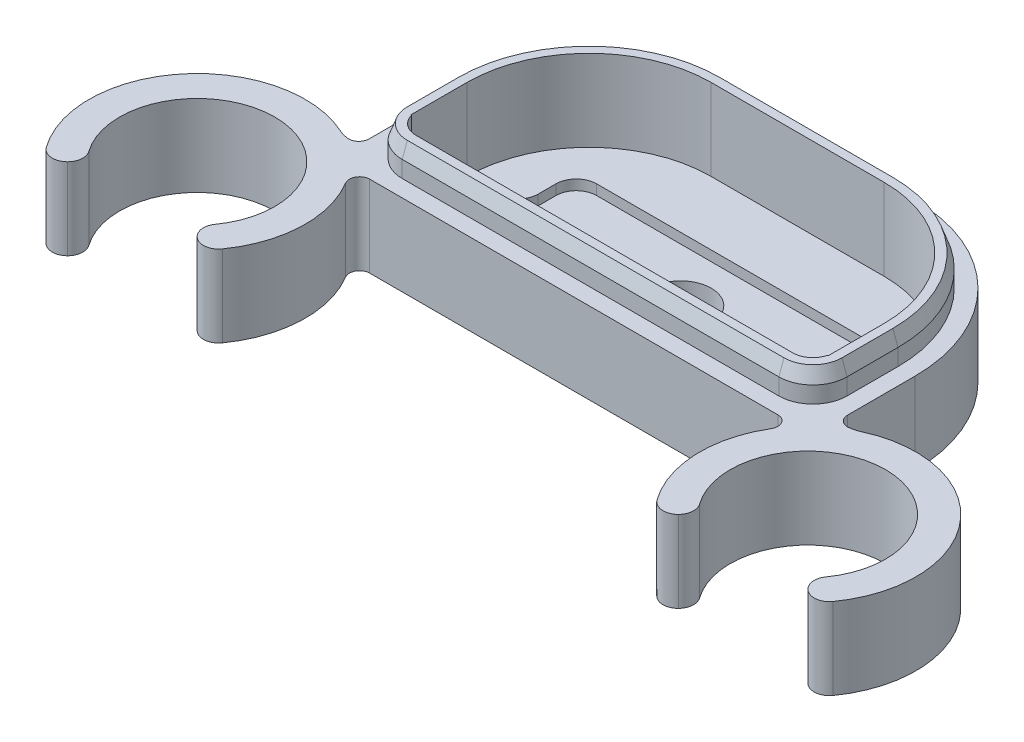
from build123d import *

# Parameters (mm, degrees)
SKETCH1_W               = 47
SKETCH1_H               = 25
BOSS_EXTRUDE1_DEPTH     = 8
SHELL1_T                = -3
SKETCH4_R               = 3
SKETCH4_W               = 9.5
SKETCH4_H               = 4.5
CUT_EXTRUDE4_DEPTH      = 28.793884219
FILLET2_R               = 12
FILLET3_R               = 15
SKETCH5_R               = 7.625
BOSS_EXTRUDE3_DEPTH     = 8
FILLET7_R               = 2
FILLET9_R               = 3
FILLET10_R              = 3
BOSS_EXTRUDE4_DEPTH     = 3
FILLET11_R              = 1
CHAMFER1_SIZE           = 0.5
CHAMFER1_SIZE2          = 1.37373871
CUT_EXTRUDE5_DEPTH      = 10
CUT_EXTRUDE5_DEPTH_BACK = 1
CUT_EXTRUDE6_DEPTH      = 10
FILLET12_R              = 1.5


# Some blends are built 0.0001 mm under size
with BuildPart() as part:
    # Sketch1 → Boss-Extrude1 (new body)
    with BuildSketch(Plane(origin=(0, 0, 0), x_dir=(1, 0, 0), z_dir=(0, 1, 0))):
        Rectangle(SKETCH1_W, SKETCH1_H)
    extrude(amount=BOSS_EXTRUDE1_DEPTH)

    # Shell1
    shell1_openings = [part.faces().sort_by_distance(p)[0] for p in [
        (0, 8, 0),
    ]]
    offset(amount=SHELL1_T, openings=shell1_openings, kind=Kind.INTERSECTION)

    # Sketch4 → Cut-Extrude4 (cut, through all)
    with BuildSketch(Plane.XZ):
        with Locations(Location((0, 2, 0), (0, 0, 270))):
            Circle(SKETCH4_R)
        with Locations((10.75, 4.5)):
            Rectangle(SKETCH4_W, SKETCH4_H)
        with Locations((-10.75, 4.5)):
            Rectangle(SKETCH4_W, SKETCH4_H)
    extrude(amount=-CUT_EXTRUDE4_DEPTH, mode=Mode.SUBTRACT)

    # Fillet2
    fillet2_edges = [part.edges().sort_by_distance(p)[0] for p in [
        (-20.5, 5.5, -9.5),
        (20.5, 5.5, -9.5),
    ]]
    fillet(fillet2_edges, radius=FILLET2_R)

    # Fillet3
    fillet3_edges = [part.edges().sort_by_distance(p)[0] for p in [
        (-23.5, 4, -12.5),
        (23.5, 4, -12.5),
    ]]
    fillet(fillet3_edges, radius=FILLET3_R)

    # Sketch5 → Boss-Extrude3 (add)
    # profile 1 of 2: a face of its own
    with BuildSketch(Plane(origin=(0, 0, 0), x_dir=(1, 0, 0), z_dir=(0, 1, 0))):
        with BuildLine():
            Line((-24.109061312, -10.65763231), (-23.023781022, -9.5))
            Line((-23.023781022, -9.5), (-18.817115042, -9.5))
            Line((-18.817115042, -9.5), (-21.851077989, -12.681958121))
            ThreePointArc((-21.851077989, -12.681958121), (-37.092523941, -27.411177481), (-24.109061312, -10.65763231))
        make_face()
        with Locations(Location((-30, -19.5, 0), (0, 0, 270))):
            Circle(SKETCH5_R, mode=Mode.SUBTRACT)
    # profile 2 of 2: a face of its own
    with BuildSketch(Plane(origin=(0, 0, 0), x_dir=(1, 0, 0), z_dir=(0, 1, 0))):
        with BuildLine():
            Line((21.851077989, -12.681958121), (18.817115042, -9.5))
            Line((18.817115042, -9.5), (23.023781022, -9.5))
            Line((23.023781022, -9.5), (24.109061312, -10.65763231))
            ThreePointArc((24.109061312, -10.65763231), (37.092523941, -27.411177481), (21.851077989, -12.681958121))
        make_face()
        with Locations(Location((30, -19.5, 0), (0, 0, 90))):
            Circle(SKETCH5_R, mode=Mode.SUBTRACT)
    extrude(amount=BOSS_EXTRUDE3_DEPTH)

    # Fillet7
    fillet7_edges = [part.edges().sort_by_distance(p)[0] for p in [
        (-20.5, 5.5, 9.5),
        (20.5, 5.5, 9.5),
    ]]
    fillet(fillet7_edges, radius=FILLET7_R)

    # Fillet9
    # the kernel refuses this fillet: 3 mm, written as the material it adds along each edge
    with BuildSketch(Plane(origin=(-24.109061312, 0, 10.65763231), x_dir=(-0.8731241588548913, 0, -0.48749790073798127), z_dir=(0, 1, 0))) as fillet9_piece_1:
        with BuildLine():
            CenterArc((1.900937986, -2.990768498), FILLET9_R, 94.495982628, 40.36086399)
            Line((-0.215075627, -0.864154666), (-0.2573959, -0.82162239))
            ThreePointArc((-0.2573959, -0.82162239), (-0.165761599, -0.417586273), (-0.058223785, 0.01449106))
            Line((-0.058223785, 0.01449106), (0.004703352, 0.05981537))
            ThreePointArc((0.004703352, 0.05981537), (0.8328852, 0.027305096), (1.661067049, 0.05981537))
            Line((1.661067049, 0.05981537), (1.6657704, 0))
        make_face()
    extrude(amount=8)
    with BuildSketch(Plane(origin=(24.109061312, 0, 10.65763231), x_dir=(-0.6839411288813303, 0, -0.7295372041400846), z_dir=(0, 1, 0))) as fillet9_piece_2:
        with BuildLine():
            CenterArc((2.443120942, -2.566986852), FILLET9_R, 121.167021746, 40.36086399)
            Line((-0.402312981, -1.616457637), (-0.45922166, -1.597447053))
            ThreePointArc((-0.45922166, -1.597447053), (-0.227653258, -0.801634155), (-0.059180564, 0.009882353))
            Line((-0.059180564, 0.009882353), (0, 0.06))
            ThreePointArc((0, 0.06), (0.44525858, 0.06), (0.859465085, 0.051339737))
            Line((0.859465085, 0.051339737), (0.89051716, 0))
        make_face()
    extrude(amount=8)

    # Fillet10
    # the kernel refuses this fillet: 3 mm, written as the material it adds along each edge
    with BuildSketch(Plane(origin=(-21.851077989, 0, 12.681958121), x_dir=(0.6041926909004034, 0, 0.796838247238754), z_dir=(0, 1, 0))) as fillet10_piece_1:
        with BuildLine():
            CenterArc((1.162533412, 2.99655072), FILLET10_R, 246.365543593, 20.886670937)
            Line((-0.040166708, 0.248185312), (-0.064220711, 0.193218004))
            ThreePointArc((-0.064220711, 0.193218004), (-0.07931268, 0.114506887), (-0.059229326, -0.009585769))
            Line((-0.059229326, -0.009585769), (0.002876371, -0.059931014))
            ThreePointArc((0.002876371, -0.059931014), (0.509357423, -0.047783801), (1.015838475, -0.059931014))
            Line((1.015838475, -0.059931014), (1.018714846, 0))
        make_face()
    extrude(amount=8)
    with BuildSketch(Plane(origin=(21.851077989, 0, 12.681958121), x_dir=(-0.6041926909004038, 0, 0.7968382472387535), z_dir=(0, 1, 0))) as fillet10_piece_2:
        with BuildLine():
            CenterArc((1.162533412, -2.99655072), FILLET10_R, 92.74778547, 20.886670937)
            Line((-0.040166708, -0.248185312), (-0.064220711, -0.193218004))
            ThreePointArc((-0.064220711, -0.193218004), (-0.07931268, -0.114506887), (-0.059229326, 0.009585769))
            Line((-0.059229326, 0.009585769), (0.002876371, 0.059931014))
            ThreePointArc((0.002876371, 0.059931014), (0.509357423, 0.047783801), (1.015838475, 0.059931014))
            Line((1.015838475, 0.059931014), (1.018714846, 0))
        make_face()
    extrude(amount=8)

    # Sketch6 → Boss-Extrude4 (add)
    with BuildSketch(Plane(origin=(0, 8, 0), x_dir=(1, 0, 0), z_dir=(0, 1, 0))):
        with BuildLine():
            Line((-21.85, -2.5), (-21.85, -7.5))
            ThreePointArc((-21.85, -7.5), (-20.868807717, -9.868807717), (-18.5, -10.85))
            Line((-18.5, -10.85), (18.5, -10.85))
            ThreePointArc((18.5, -10.85), (20.868807717, -9.868807717), (21.85, -7.5))
            Line((21.85, -7.5), (21.85, -2.5))
            ThreePointArc((21.85, -2.5), (17.939875529, 6.939875529), (8.5, 10.85))
            Line((8.5, 10.85), (-8.5, 10.85))
            ThreePointArc((-8.5, 10.85), (-17.939875529, 6.939875529), (-21.85, -2.5))
        make_face()
        with BuildLine():
            Line((-18.5, -9.5), (18.5, -9.5))
            ThreePointArc((18.5, -9.5), (19.914213562, -8.914213562), (20.5, -7.5))
            Line((20.5, -7.5), (20.5, -2.5))
            ThreePointArc((20.5, -2.5), (16.985281374, 5.985281374), (8.5, 9.5))
            Line((8.5, 9.5), (-8.5, 9.5))
            ThreePointArc((-8.5, 9.5), (-16.985281374, 5.985281374), (-20.5, -2.5))
            Line((-20.5, -2.5), (-20.5, -7.5))
            ThreePointArc((-20.5, -7.5), (-19.914213562, -8.914213562), (-18.5, -9.5))
        make_face(mode=Mode.SUBTRACT)
    extrude(amount=BOSS_EXTRUDE4_DEPTH)

    # Fillet11
    fillet11_edges = [part.edges().sort_by_distance(p)[0] for p in [
        (21.677582872, 4, 12.5),
        (23.5, 4, 10.00796691),
        (-21.677582872, 4, 12.5),
        (-23.5, 4, 10.00796691),
    ]]
    fillet(fillet11_edges, radius=FILLET11_R)

    # Chamfer1
    chamfer1_edges = [part.edges().sort_by_distance(p)[0] for p in [
        (-17.939875529, 11, -6.939875529),
        (-21.85, 11, 5),
        (-20.868807717, 11, 9.868807717),
        (0, 11, 10.85),
        (20.868807717, 11, 9.868807717),
        (21.85, 11, 5),
        (17.939875529, 11, -6.939875529),
        (0, 11, -10.85),
    ]]
    chamfer1_side = [part.faces().sort_by_distance(p)[0] for p in [
        (-21.362088123, 11, 5),
    ]]
    chamfer(chamfer1_edges, length=CHAMFER1_SIZE, length2=CHAMFER1_SIZE2, reference=chamfer1_side[0])

    # Sketch7 → Cut-Extrude5 (cut, two sides: drawn at the far end of the back side and taken through both)
    with BuildSketch(Plane(origin=(0, 3, 0), x_dir=(1, 0, 0), z_dir=(0, 1, 0)).offset(-CUT_EXTRUDE5_DEPTH_BACK)):
        with BuildLine():
            Line((-20.5, -6.75), (-20.5, -2.5))
            Line((-20.5, -2.5), (-17.5, -2.5))
            ThreePointArc((-17.5, -2.5), (-16.085786438, -1.914213562), (-15.5, -0.5))
            Line((-15.5, -0.5), (-15.5, 1.25))
            ThreePointArc((-15.5, 1.25), (-14.914213562, 2.664213562), (-13.5, 3.25))
            Line((-13.5, 3.25), (13.5, 3.25))
            ThreePointArc((13.5, 3.25), (14.914213562, 2.664213562), (15.5, 1.25))
            Line((15.5, 1.25), (15.5, -0.5))
            ThreePointArc((15.5, -0.5), (16.085786438, -1.914213562), (17.5, -2.5))
            Line((17.5, -2.5), (20.5, -2.5))
            Line((20.5, -2.5), (20.5, -6.75))
            Line((20.5, -6.75), (20.5, -8))
            Line((20.5, -8), (-20.5, -8))
            Line((-20.5, -8), (-20.5, -6.75))
        make_face()
    extrude(amount=CUT_EXTRUDE5_DEPTH + CUT_EXTRUDE5_DEPTH_BACK, mode=Mode.SUBTRACT)

    # Sketch8 → Cut-Extrude6 (cut)
    with BuildSketch(Plane.XZ):
        Polygon((-30, 19.5), (-42.679355302, 32.179355302), (-17.320644698, 32.179355302), align=None)
        Polygon((42.679355302, 32.179355302), (17.320644698, 32.179355302), (30, 19.5), align=None)
    extrude(amount=-CUT_EXTRUDE6_DEPTH, mode=Mode.SUBTRACT)

    # Fillet12
    fillet12_edges = [part.edges().sort_by_distance(p)[0] for p in [
        (37.51300955, 4, 27.01300955),
        (35.391689207, 4, 24.891689207),
        (24.608310793, 4, 24.891689207),
        (22.48699045, 4, 27.01300955),
        (-24.608310793, 4, 24.891689207),
        (-22.48699045, 4, 27.01300955),
        (-35.391689207, 4, 24.891689207),
        (-37.51300955, 4, 27.01300955),
    ]]
    fillet(fillet12_edges, radius=FILLET12_R - 0.0001)  # a hair under: the kernel refuses the full size


solid = part.part
